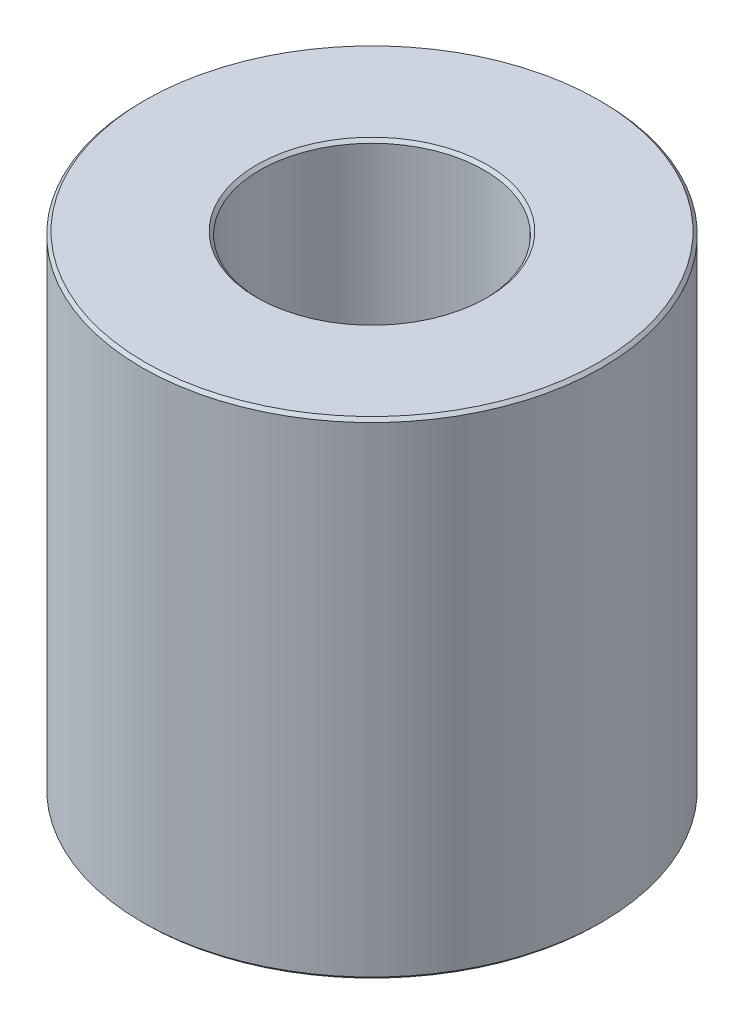
from build123d import *

# Parameters (mm, degrees)
SKETCH1_R           = 37.5
BOSS_EXTRUDE1_DEPTH = 79.272332569
SKETCH2_R           = 18.273339466
CUT_EXTRUDE1_DEPTH  = 96.376111846
CHAMFER1_SIZE       = 0.500498882


with BuildPart() as part:
    # Sketch1 → Boss-Extrude1 (new body)
    with BuildSketch(Plane(origin=(0, 0, 0), x_dir=(1, 0, 0), z_dir=(0, 1, 0))):
        Circle(SKETCH1_R)
    extrude(amount=BOSS_EXTRUDE1_DEPTH)

    # Sketch2 → Cut-Extrude1 (cut, through all)
    with BuildSketch(Plane(origin=(0, 0, 0), x_dir=(1, 0, 0), z_dir=(0, 1, 0))):
        Circle(SKETCH2_R)
    extrude(amount=CUT_EXTRUDE1_DEPTH, mode=Mode.SUBTRACT)

    # Chamfer1
    chamfer1_edges = [part.edges().sort_by_distance(p)[0] for p in [
        (-18.273339466, 79.272332569, 0),
        (-18.273339466, 0, 0),
        (-37.5, 0, 0),
        (-37.5, 79.272332569, 0),
    ]]
    chamfer(chamfer1_edges, length=CHAMFER1_SIZE)


solid = part.part
